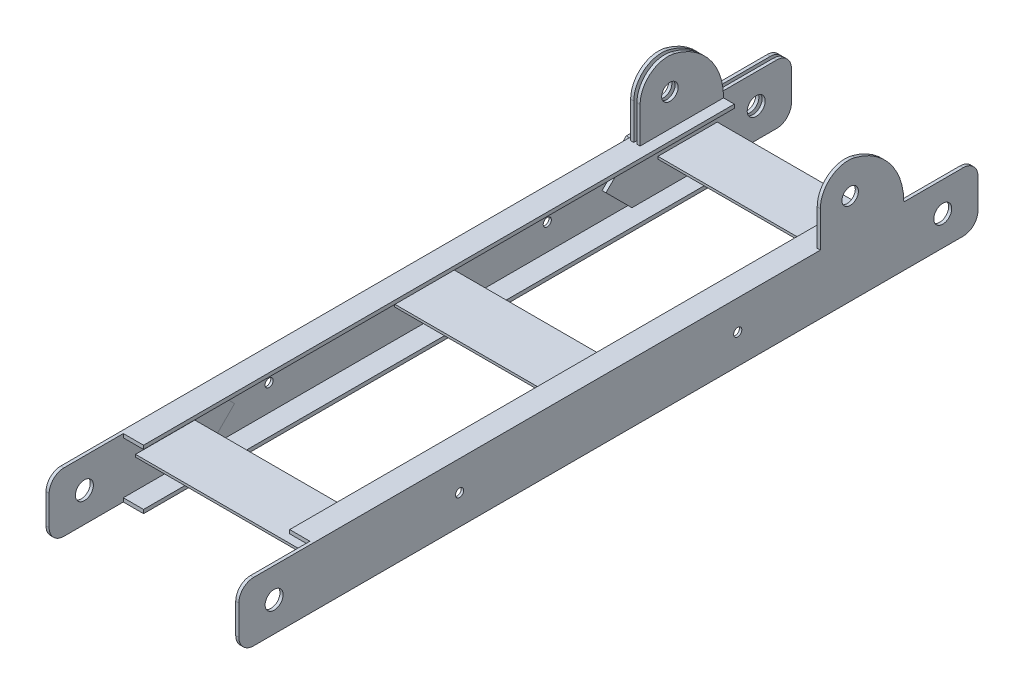
from build123d import *

# Parameters (mm, degrees)
EXTRUDE_1_DEPTH        = 1992.775637732
EXTRUDE_1_2_DEPTH      = 1992.775637732
EXTRUDE_3_DEPTH        = 520
PATTERN_LINEAR_1_COUNT = 3
PATTERN_LINEAR_1_PITCH = 700
EXTRUDE_5_DEPTH        = 2
EXTRUDE_8_DEPTH        = 2
EXTRUDE_11_DEPTH       = 8.5
PATTERN_LINEAR_2_COUNT = 2
PATTERN_LINEAR_2_PITCH = 17
SKETCH_6_W             = 494.5
SKETCH_6_H             = 200
SKETCH_6_W_2           = 503
SKETCH_6_W_3           = 8.5
CUT_EXTRUDE_12_DEPTH   = 2066.709258908
SKETCH_20_R            = 24.25
CUT_EXTRUDE_13_DEPTH   = 2068.865322582
FILLET_1_R             = 40
SKETCH_21_W            = 8.5
SKETCH_21_H            = 225
EXTRUDE_14_DEPTH       = 175
SKETCH_22_R            = 22.25
CUT_EXTRUDE_15_DEPTH   = 2089.705817567
FILLET_2_R             = 175
FILLET_3_R             = 75
SKETCH_23_R            = 11
CUT_EXTRUDE_16_DEPTH   = 2089.198879915


with BuildPart() as part:
    # 草图2 → 拉伸1 (new body)
    with BuildSketch(Plane.XY):
        Polygon((0, 0), (0, 160), (63, 160), (63, 150), (6.5, 150), (6.5, 10), (63, 10), (63, 0), align=None)
    extrude(amount=EXTRUDE_1_DEPTH)



with BuildPart() as body_2:
    # 草图2 → Extrude 1 2 (new body)
    with BuildSketch(Plane.XY):
        Polygon((457, 160), (520, 160), (520, 0), (457, 0), (457, 10), (513.5, 10), (513.5, 150), (457, 150), align=None)
    extrude(amount=EXTRUDE_1_2_DEPTH)


with BuildPart() as part_1:
    add(part.part)

    add(body_2.part)  # 拉伸3 merges body 2
    # 草图5 → 拉伸3 (add)
    with BuildSketch(Plane.ZY):
        Polygon((200, 95), (360, 95), (360, 88.5), (283.25, 88.5), (283.25, 48.5), (276.75, 48.5), (276.75, 88.5), (200, 88.5), align=None)
    extrude_3 = extrude(amount=-EXTRUDE_3_DEPTH)

    # 阵列(线性)1: 拉伸3 ×3
    with Locations(*[(0, 0, i * PATTERN_LINEAR_1_PITCH) for i in range(1, PATTERN_LINEAR_1_COUNT)]):
        add(extrude_3)

    # 草图7 → 拉伸5 (add)
    with BuildSketch(Plane.ZY.offset(-513.5)):
        Polygon((0, 10), (500, 10), (570, 80), (500, 150), (0, 150), align=None)
        Polygon((1562.775637732, 150), (1492.775637732, 80), (1562.775637732, 10), (1992.775637732, 10), (1992.775637732, 150), align=None)
    extrude(amount=EXTRUDE_5_DEPTH)

    # 草图15 → 拉伸8 (add)
    with BuildSketch(Plane(origin=(6.5, 0, 0), x_dir=(0, 0, -1), z_dir=(1, 0, 0))):
        Polygon((-1992.775637732, 150), (-1562.775637732, 150), (-1492.775637732, 80), (-1562.775637732, 10), (-1992.775637732, 10), align=None)
        Polygon((-430, 150), (0, 150), (0, 10), (-430, 10), (-500, 80), align=None)
    extrude(amount=EXTRUDE_8_DEPTH)

    # 草图19 → 拉伸11 (add)
    with BuildSketch(Plane.ZY):
        Polygon((0, 160), (420, 160), (500, 80), (420, 0), (0, 0), align=None)
    extrude_11 = extrude(amount=EXTRUDE_11_DEPTH)

    # 阵列(线性)2: 拉伸11 ×2
    with Locations(*[(i * PATTERN_LINEAR_2_PITCH, 0, 0) for i in range(1, PATTERN_LINEAR_2_COUNT)]):
        add(extrude_11)

    # 草图6 → 拉伸12 (cut, through all)
    with BuildSketch(Plane(origin=(0, 160, 0), x_dir=(1, 0, 0), z_dir=(0, 1, 0))):
        with Locations((264.25, -100)):
            Rectangle(SKETCH_6_W, SKETCH_6_H)
        with Locations((260, -1892.775637732)):
            Rectangle(SKETCH_6_W_2, SKETCH_6_H)
        with Locations((4.25, -100)):
            Rectangle(SKETCH_6_W_3, SKETCH_6_H)
    extrude(amount=-CUT_EXTRUDE_12_DEPTH, mode=Mode.SUBTRACT)

    # 草图20 → 拉伸13 (cut, through all)
    with BuildSketch(Plane.ZY.offset(8.5)):
        with Locations((95, 80)):
            Circle(SKETCH_20_R)
        with Locations(Location((1897.775637732, 80, 0), (0, 0, 90))):
            Circle(SKETCH_20_R)
    extrude(amount=-CUT_EXTRUDE_13_DEPTH, mode=Mode.SUBTRACT)

    # 圆角1
    fillet_1_edges = [part_1.edges().sort_by_distance(p)[0] for p in [
        (4.25, 0, 1992.775637732),
        (4.25, 160, 1992.775637732),
        (515.75, 0, 1992.775637732),
        (515.75, 160, 1992.775637732),
        (-4.25, 0, 0),
        (12.75, 0, 0),
        (-4.25, 160, 0),
        (12.75, 160, 0),
        (515.75, 0, 0),
        (515.75, 160, 0),
    ]]
    fillet(fillet_1_edges, radius=FILLET_1_R)

    # 草图21 → 拉伸14 (add)
    with BuildSketch(Plane(origin=(0, 160, 0), x_dir=(1, 0, 0), z_dir=(0, 1, 0))):
        with Locations((515.75, -312.5)):
            Rectangle(SKETCH_21_W, SKETCH_21_H)
        with Locations((12.75, -312.5)):
            Rectangle(SKETCH_21_W, SKETCH_21_H)
        with Locations((29.75, -312.5)):
            Rectangle(SKETCH_21_W, SKETCH_21_H)
    extrude(amount=EXTRUDE_14_DEPTH)

    # 草图22 → 拉伸15 (cut, through all)
    with BuildSketch(Plane.ZY.offset(8.5)):
        with Locations((344.615088301, 246.410058868)):
            Circle(SKETCH_22_R)
    extrude(amount=-CUT_EXTRUDE_15_DEPTH, mode=Mode.SUBTRACT)

    # 圆角2
    fillet_2_edges = [part_1.edges().sort_by_distance(p)[0] for p in [
        (12.75, 335, 200),
        (515.75, 335, 200),
        (29.75, 335, 200),
    ]]
    fillet(fillet_2_edges, radius=FILLET_2_R - 0.0001)  # a hair under: the kernel refuses the full size

    # 圆角3
    fillet_3_edges = [part_1.edges().sort_by_distance(p)[0] for p in [
        (12.75, 335, 425),
        (515.75, 335, 425),
        (29.75, 335, 425),
    ]]
    fillet(fillet_3_edges, radius=FILLET_3_R)

    # 草图23 → 拉伸16 (cut, through all)
    with BuildSketch(Plane(origin=(520, 0, 0), x_dir=(0, 0, -1), z_dir=(1, 0, 0))):
        with Locations((-1397.775637732, 80)):
            Circle(SKETCH_23_R)
        with Locations((-647.775637732, 80)):
            Circle(SKETCH_23_R)
    extrude(amount=-CUT_EXTRUDE_16_DEPTH, mode=Mode.SUBTRACT)


solid = part_1.part
